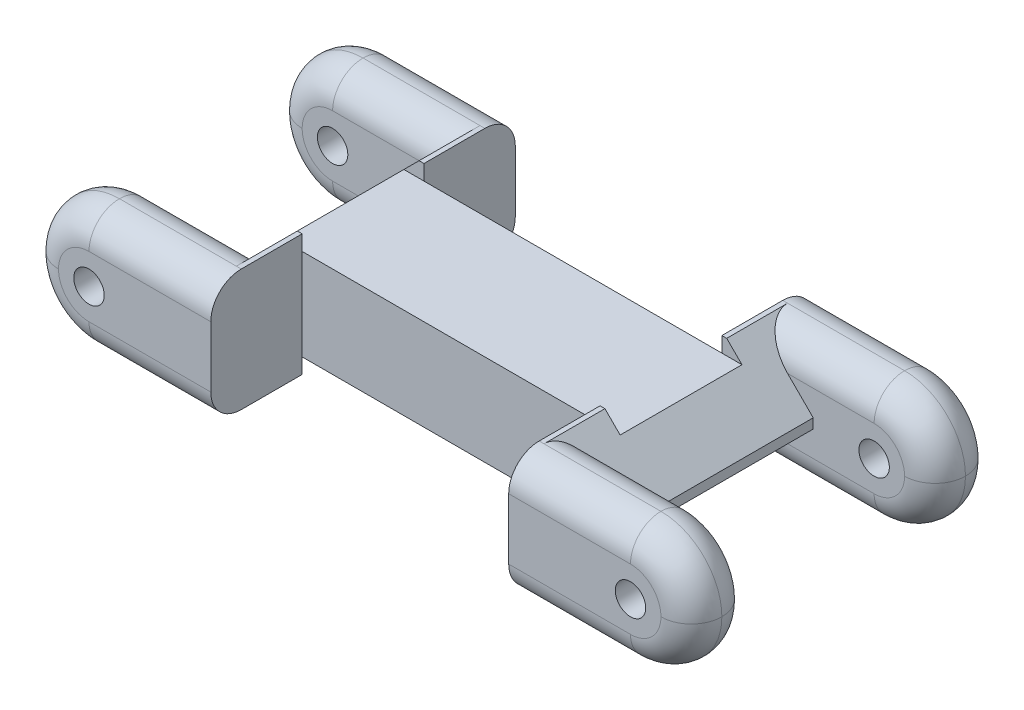
from build123d import *

# Parameters (mm, degrees)
BOSS_EXTRUDE1_DEPTH = 12.7
SKETCH2_R           = 1.5875
CUT_EXTRUDE1_DEPTH  = 67.009021317
FILLET5_R           = 6.35
FILLET6_R           = 3.175
CHAMFER1_START      = -12.7
CHAMFER1_DEPTH      = 25.4
CHAMFER1_2_DEPTH    = 5.842
CHAMFER1_START_2    = 37.918945752
CHAMFER1_3_DEPTH    = 5.842
CUT_EXTRUDE2_REACH  = 62.01
SKETCH4_W           = 12.7
SKETCH4_H           = 1.5875


with BuildPart() as part:
    # Sketch1 → Boss-Extrude1 (new body)
    with BuildSketch(Plane(origin=(0, 0, 0), x_dir=(1, 0, 0), z_dir=(0, 1, 0))):
        Polygon((0, 9.525), (-12.7, 9.525), (-12.7, 15.875), (6.35, 15.875), (6.35, 6.35), (37.410945752, 6.35), (37.410945752, 15.875), (56.460945752, 15.875), (56.460945752, 9.525), (43.760945752, 9.525), (43.760945752, -9.525), (56.460945752, -9.525), (56.460945752, -15.875), (37.410945752, -15.875), (37.410945752, -6.35), (6.35, -6.35), (6.35, -15.875), (-12.7, -15.875), (-12.7, -9.525), (0, -9.525), align=None)
    extrude(amount=BOSS_EXTRUDE1_DEPTH)

    # Sketch2 → Cut-Extrude1 (cut, through all)
    with BuildSketch(Plane.XY.offset(15.875)):
        with Locations((50.110945752, 6.35)):
            Circle(SKETCH2_R)
        with Locations((-6.35, 6.35)):
            Circle(SKETCH2_R)
    extrude(amount=-CUT_EXTRUDE1_DEPTH, mode=Mode.SUBTRACT)

    # Fillet5
    fillet5_edges = [part.edges().sort_by_distance(p)[0] for p in [
        (56.460945752, 0, 12.7),
        (56.460945752, 12.7, 12.7),
        (56.460945752, 0, -12.7),
        (56.460945752, 12.7, -12.7),
        (-12.7, 12.7, 12.7),
        (-12.7, 0, 12.7),
        (-12.7, 0, -12.7),
        (-12.7, 12.7, -12.7),
    ]]
    fillet(fillet5_edges, radius=FILLET5_R - 0.0001)  # a hair under: the kernel refuses the full size

    # Fillet6
    fillet6_edges = [part.edges().sort_by_distance(p)[0] for p in [
        (43.760995752, 0, 15.875),
        (54.601103102, 1.85984265, 15.875),
        (54.601103102, 10.84015735, 15.875),
        (43.760995752, 0, -15.875),
        (54.601103102, 1.85984265, -15.875),
        (54.601103102, 10.84015735, -15.875),
        (-5e-05, 0, -15.875),
        (-10.84015735, 1.85984265, -15.875),
        (-10.84015735, 10.84015735, -15.875),
        (-5e-05, 12.7, 15.875),
        (-5e-05, 0, 15.875),
        (-10.84015735, 1.85984265, 15.875),
        (-3.17505, 12.7, -9.525),
        (-3.17505, 0, -9.525),
        (-10.84015735, 1.85984265, -9.525),
        (-3.17505, 0, 9.525),
        (-10.84015735, 1.85984265, 9.525),
        (-3.17505, 12.7, 9.525),
        (46.935995752, 0, -9.525),
        (54.601103102, 1.85984265, -9.525),
        (46.935995752, 12.7, -9.525),
        (46.935995752, 12.7, 9.525),
        (46.935995752, 0, 9.525),
        (54.601103102, 1.85984265, 9.525),
        (43.760995752, 12.7, 15.875),
        (43.760995752, 12.7, -15.875),
        (-5e-05, 12.7, -15.875),
        (-10.84015735, 10.84015735, 15.875),
        (-10.84015735, 10.84015735, -9.525),
        (-10.84015735, 10.84015735, 9.525),
        (54.601103102, 10.84015735, -9.525),
        (54.601103102, 10.84015735, 9.525),
    ]]
    fillet(fillet6_edges, radius=FILLET6_R - 0.0001)  # a hair under: the kernel refuses the full size

    # Chamfer1: read off the stored shape, not the designer's step
    # Chamfer1 outline → Chamfer1 (cut)
    with BuildSketch(Plane.XY.offset(CHAMFER1_START)):
        Polygon((43.760945752, 5.842), (37.918945752, 0), (43.760945752, 0), align=None)
        Polygon((0, 0), (5.842, 0), (0, 5.842), align=None)
        Polygon((37.918945752, 12.7), (43.760945752, 6.858), (43.760945752, 12.7), align=None)
        Polygon((0, 12.7), (0, 6.858), (5.842, 12.7), align=None)
    extrude(amount=CHAMFER1_DEPTH, mode=Mode.SUBTRACT)

    # Chamfer1 2 outline → Chamfer1 2 (add)
    with BuildSketch(Plane.YZ):
        with BuildLine():
            Line((6.858, 9.525), (9.525, 9.525))
            ThreePointArc((9.525, 9.525), (11.77006403, 10.45493597), (12.7, 12.7))
            Line((12.7, 12.7), (6.858, 12.7))
            Line((6.858, 12.7), (6.858, 9.525))
        make_face()
        with BuildLine():
            ThreePointArc((3.175, -9.525), (0.92993597, -10.45493597), (0, -12.7))
            Line((0, -12.7), (5.842, -12.7))
            Line((5.842, -12.7), (5.842, -9.525))
            Line((5.842, -9.525), (3.175, -9.525))
        make_face()
        with BuildLine():
            Line((6.858, -9.525), (6.858, -12.7))
            Line((6.858, -12.7), (12.7, -12.7))
            ThreePointArc((12.7, -12.7), (11.77006403, -10.45493597), (9.525, -9.525))
            Line((9.525, -9.525), (6.858, -9.525))
        make_face()
        with BuildLine():
            ThreePointArc((0, 12.7), (0.92993597, 10.45493597), (3.175, 9.525))
            Line((3.175, 9.525), (5.842, 9.525))
            Line((5.842, 9.525), (5.842, 12.7))
            Line((5.842, 12.7), (0, 12.7))
        make_face()
    extrude(amount=CHAMFER1_2_DEPTH)

    # Chamfer1 3 outline → Chamfer1 3 (add)
    with BuildSketch(Plane.YZ.offset(CHAMFER1_START_2)):
        with BuildLine():
            Line((6.858, 9.525), (9.525, 9.525))
            ThreePointArc((9.525, 9.525), (11.77006403, 10.45493597), (12.7, 12.7))
            Line((12.7, 12.7), (6.858, 12.7))
            Line((6.858, 12.7), (6.858, 9.525))
        make_face()
        with BuildLine():
            ThreePointArc((3.175, -9.525), (0.92993597, -10.45493597), (0, -12.7))
            Line((0, -12.7), (5.842, -12.7))
            Line((5.842, -12.7), (5.842, -9.525))
            Line((5.842, -9.525), (3.175, -9.525))
        make_face()
        with BuildLine():
            Line((6.858, -9.525), (6.858, -12.7))
            Line((6.858, -12.7), (12.7, -12.7))
            ThreePointArc((12.7, -12.7), (11.77006403, -10.45493597), (9.525, -9.525))
            Line((9.525, -9.525), (6.858, -9.525))
        make_face()
        with BuildLine():
            ThreePointArc((0, 12.7), (0.92993597, 10.45493597), (3.175, 9.525))
            Line((3.175, 9.525), (5.842, 9.525))
            Line((5.842, 9.525), (5.842, 12.7))
            Line((5.842, 12.7), (0, 12.7))
        make_face()
    extrude(amount=CHAMFER1_3_DEPTH)

    # Cut-Extrude2: up to this plane
    cut_extrude2_end = Plane(origin=(5.842, 12.7, 0), z_dir=(0.7071067811865497, -0.7071067811865455, 0))
    # Sketch4 → Cut-Extrude2 (cut, up to the surface)
    with BuildSketch(Plane(origin=(43.760945752, 0, 0), x_dir=(0, 0, -1), z_dir=(1, 0, 0)), mode=Mode.PRIVATE) as cut_extrude2_sk1:
        with Locations((0, 11.90625)):
            Rectangle(SKETCH4_W, SKETCH4_H)
    cut_extrude2_tool1 = split(extrude(cut_extrude2_sk1.sketch, amount=-CUT_EXTRUDE2_REACH, mode=Mode.PRIVATE), bisect_by=cut_extrude2_end, keep=Keep.BOTH, mode=Mode.PRIVATE)
    add(cut_extrude2_tool1.solids().sort_by_distance((43.760946, 11.90625, 0))[0], mode=Mode.SUBTRACT)
    # Sketch4 → Cut-Extrude2 (cut, up to the surface)
    with BuildSketch(Plane(origin=(43.760945752, 0, 0), x_dir=(0, 0, -1), z_dir=(1, 0, 0)), mode=Mode.PRIVATE) as cut_extrude2_sk2:
        with Locations((0, 0.79375)):
            Rectangle(SKETCH4_W, SKETCH4_H)
    cut_extrude2_tool2 = split(extrude(cut_extrude2_sk2.sketch, amount=-CUT_EXTRUDE2_REACH, mode=Mode.PRIVATE), bisect_by=cut_extrude2_end, keep=Keep.BOTH, mode=Mode.PRIVATE)
    add(cut_extrude2_tool2.solids().sort_by_distance((43.760946, 0.79375, 0))[0], mode=Mode.SUBTRACT)


solid = part.part
